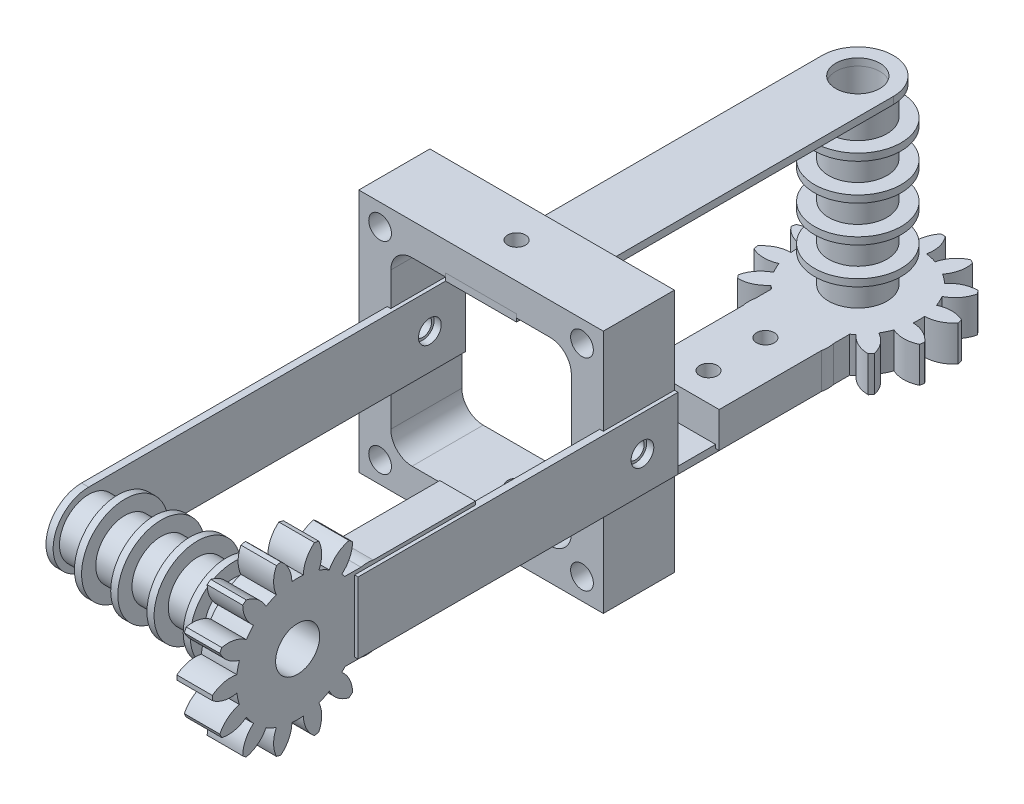
from build123d import *
from build123d.topology import SkipClean

# Parameters (mm, degrees)
BASPROSKE_W              = 5
BASPROSKE_H              = 12
TOOTHCUT_DEPTH           = 18.691806013
TEETHCUTS_COUNT          = 14
TEETHCUTS_ANGLE          = 334.285714286
BORSKE_R                 = 3.1
BORE_DEPTH               = 50.0000508
SKETCH_2_W               = 20
SKETCH_2_H               = 11
EXTRUDE_1_DEPTH          = 5
SKETCH_3_W               = 17
SKETCH_3_H               = 10
CUT_EXTRUDE_1_DEPTH      = 0.5
SKETCH_5_W               = 10
SKETCH_5_H               = 10
SKETCH_5_W_2             = 8
SKETCH_5_H_2             = 8
EXTRUDE_2_DEPTH          = 40
SKETCH_12_W              = 9
SKETCH_12_H              = 10
CUT_EXTRUDE_4_DEPTH      = 63.83857643
CUT_EXTRUDE_2_DEPTH      = 50.726116758
CUT_EXTRUDE_2_DEPTH_BACK = 50.726116758
SKETCH_4_R               = 1.25
SKETCH_7_R               = 4.1
SKETCH_7_R_2             = 3.1
EXTRUDE_3_DEPTH          = 4
PATTERN_LINEAR_1_COUNT   = 5
PATTERN_LINEAR_1_PITCH   = 5.1
SKETCH_14_R              = 3.1
EXTRUDE_5_DEPTH          = 1
SKETCH_15_W              = 34.4
SKETCH_15_H              = 34.4
SKETCH_15_R              = 1.6
EXTRUDE_6_DEPTH          = 5
SKETCH_17_R              = 6.1
SKETCH_17_R_2            = 3.1
EXTRUDE_8_DEPTH          = 1
PATTERN_LINEAR_3_COUNT   = 4
PATTERN_LINEAR_3_PITCH   = 5.1
PATTERN_LINEAR_2_COUNT   = 2
PATTERN_LINEAR_2_PITCH   = 100
MOVE_BODY_2_ANGLE        = 180
MOVE_BODY_2_2_ANGLE      = 180
MOVE_BODY_2_3_ANGLE      = 180
MOVE_BODY_2_4_ANGLE      = 180
MOVE_BODY_2_5_ANGLE      = 180
MOVE_BODY_2_6_ANGLE      = 180
MOVE_BODY_2_7_ANGLE      = 180
MOVE_BODY_2_8_ANGLE      = 180
MOVE_BODY_2_9_ANGLE      = 180
MOVE_BODY_2_10_ANGLE     = 180
MOVE_BODY_2_11_ANGLE     = 180
MOVE_BODY_2_12_ANGLE     = 180
MOVE_BODY_2_13_ANGLE     = 180
CUT_EXTRUDE_5_DEPTH      = 70.120546873
CUT_EXTRUDE_5_DEPTH_BACK = 70.120546873
SKETCH_16_W              = 10
SKETCH_16_H              = 1
SKETCH_16_W_2            = 1
SKETCH_16_H_2            = 10
EXTRUDE_7_OUTLINE_W      = 10
EXTRUDE_7_OUTLINE_H      = 1
EXTRUDE_7_DEPTH          = 5
EXTRUDE_7_2_OUTLINE_W    = 10
EXTRUDE_7_2_OUTLINE_H    = 1
EXTRUDE_7_2_DEPTH        = 5
EXTRUDE_START            = -5
EXTRUDE_7_3_OUTLINE_W    = 1
EXTRUDE_7_3_OUTLINE_H    = 10
EXTRUDE_7_3_DEPTH        = 5
EXTRUDE_7_4_OUTLINE_W    = 1
EXTRUDE_7_4_OUTLINE_H    = 10
EXTRUDE_7_4_DEPTH        = 5
SKETCH_21_R              = 1.25
CUT_EXTRUDE_6_DEPTH      = 115.870796985
SKETCH_22_R              = 1.25
CUT_EXTRUDE_7_DEPTH      = 118.244914602
SKETCH_23_R              = 1.6
CUT_EXTRUDE_8_DEPTH      = 115.870796985
SKETCH_24_R              = 1.6
CUT_EXTRUDE_9_DEPTH      = 118.244914602


with BuildPart() as part:
    # BasProSke → Base-Revolve (revolve)
    with BuildSketch(Plane(origin=(0, 0, 0), x_dir=(1, 0, 0), z_dir=(0, 1, 0)), mode=Mode.PRIVATE) as base_revolve_sk:
        with Locations((2.5, 6)):
            Rectangle(BASPROSKE_W, BASPROSKE_H)
    revolve(base_revolve_sk.sketch.rotate(Axis((-10, 0, 0), (1, 0, 0)), 180), axis=Axis((-10, 0, 0), (1, 0, 0)))

    # TooCutSke → ToothCut (cut, through all)
    with BuildSketch(Plane(origin=(0, 0, 0), x_dir=(0, 0, -1), z_dir=(1, 0, 0))):
        with BuildLine():
            ThreePointArc((0.804845511, 8.586361261), (0, 8.624), (-0.804845511, 8.586361261))
            ThreePointArc((-0.804845511, 8.586361261), (-1.237812142, 10.362618414), (-2.384428228, 11.78663426))
            ThreePointArc((-2.384428228, 11.78663426), (0, 12.0254), (2.384428228, 11.78663426))
            ThreePointArc((2.384428228, 11.78663426), (1.237812142, 10.362618414), (0.804845511, 8.586361261))
        make_face()
    toothcut = extrude(amount=TOOTHCUT_DEPTH, mode=Mode.SUBTRACT)

    # TeethCuts: ToothCut ×14 about axis
    teethcuts_axis = Axis((-10, 0, 0), (1, 0, 0))
    for i in range(1, TEETHCUTS_COUNT):
        add(toothcut.rotate(teethcuts_axis, i * TEETHCUTS_ANGLE / (TEETHCUTS_COUNT - 1)), mode=Mode.SUBTRACT)

    # BorSke → Bore (cut, symmetric)
    with BuildSketch(Plane(origin=(0, 0, 0), x_dir=(0, 0, -1), z_dir=(1, 0, 0))):
        with Locations(Location((0, 0, 0), (0, 0, 180))):
            Circle(BORSKE_R)
    extrude(amount=BORE_DEPTH, both=True, mode=Mode.SUBTRACT)

    # ｽｹｯﾁ2 → ﾎﾞｽ - 押し出し1 (add)
    with BuildSketch(Plane(origin=(5, 0, 0), x_dir=(0, 0, -1), z_dir=(1, 0, 0))):
        with Locations((15, 0)):
            Rectangle(SKETCH_2_W, SKETCH_2_H)
    extrude(amount=-EXTRUDE_1_DEPTH)

    # ｽｹｯﾁ3 → ｶｯﾄ - 押し出し1 (cut)
    with BuildSketch(Plane(origin=(5, 0, 0), x_dir=(0, 0, -1), z_dir=(1, 0, 0))):
        with Locations((16.5, 0)):
            Rectangle(SKETCH_3_W, SKETCH_3_H)
    extrude(amount=-CUT_EXTRUDE_1_DEPTH, mode=Mode.SUBTRACT)

    # ｽｹｯﾁ4 → ｶｯﾄ - 押し出し2 (cut, two sides: drawn at the far end of the back side and taken through both)
    with BuildSketch(Plane.ZY.offset(-CUT_EXTRUDE_2_DEPTH_BACK)):
        with Locations(Location((-21, 0, 0), (0, 0, 180))):
            Circle(SKETCH_4_R)
        with Locations(Location((-13, 0, 0), (0, 0, 180))):
            Circle(SKETCH_4_R)
    extrude(amount=CUT_EXTRUDE_2_DEPTH + CUT_EXTRUDE_2_DEPTH_BACK, mode=Mode.SUBTRACT)


with BuildPart() as body_2:
    # ｽｹｯﾁ5 → ﾎﾞｽ - 押し出し2 (new body)
    with BuildSketch(Plane(origin=(0, 0, -8), x_dir=(-1, 0, 0), z_dir=(0, 0, -1))):
        with Locations((-9.5, 0)):
            Rectangle(SKETCH_5_W, SKETCH_5_H)
        with Locations((-9.5, 0)):
            Rectangle(SKETCH_5_W_2, SKETCH_5_H_2, mode=Mode.SUBTRACT)
    extrude(amount=EXTRUDE_2_DEPTH)

    # ｽｹｯﾁ12 → ｶｯﾄ - 押し出し4 (cut, through all)
    with BuildSketch(Plane(origin=(0, 0, -48), x_dir=(-1, 0, 0), z_dir=(0, 0, -1))):
        with Locations((-10, 0)):
            Rectangle(SKETCH_12_W, SKETCH_12_H)
    extrude(amount=-CUT_EXTRUDE_4_DEPTH, mode=Mode.SUBTRACT)


with BuildPart() as body_3:
    # ｽｹｯﾁ7 → ﾎﾞｽ - 押し出し3 (new body)
    with BuildSketch(Plane.ZY):
        Circle(SKETCH_7_R)
        Circle(SKETCH_7_R_2, mode=Mode.SUBTRACT)
    extrude(amount=EXTRUDE_3_DEPTH)


with BuildPart() as pattern_linear_1_1:
    # 直線ﾊﾟﾀｰﾝ1: pattern copy
    add(body_3.part.moved(Location(Vector(-1, 0, 0) * (1 * PATTERN_LINEAR_1_PITCH))))


with BuildPart() as pattern_linear_1_2:
    # 直線ﾊﾟﾀｰﾝ1: pattern copy
    add(body_3.part.moved(Location(Vector(-1, 0, 0) * (2 * PATTERN_LINEAR_1_PITCH))))


with BuildPart() as pattern_linear_1_3:
    # 直線ﾊﾟﾀｰﾝ1: pattern copy
    add(body_3.part.moved(Location(Vector(-1, 0, 0) * (3 * PATTERN_LINEAR_1_PITCH))))


with BuildPart() as pattern_linear_1_4:
    # 直線ﾊﾟﾀｰﾝ1: pattern copy
    add(body_3.part.moved(Location(Vector(-1, 0, 0) * (4 * PATTERN_LINEAR_1_PITCH))))


with BuildPart() as body_8:
    # ｽｹｯﾁ14 → ﾎﾞｽ - 押し出し5 (new body)
    with BuildSketch(Plane.ZY.offset(24.4)):
        with BuildLine():
            Line((-48, 5), (0, 5))
            ThreePointArc((0, 5), (5, 0), (0, -5))
            Line((0, -5), (-48, -5))
            Line((-48, -5), (-48, 5))
        make_face()
        Circle(SKETCH_14_R, mode=Mode.SUBTRACT)
    extrude(amount=EXTRUDE_5_DEPTH)


with BuildPart() as body_9:
    # ｽｹｯﾁ15 → ﾎﾞｽ - 押し出し6 (new body)
    with BuildSketch(Plane(origin=(0, 0, -48), x_dir=(-1, 0, 0), z_dir=(0, 0, -1))):
        with Locations((12.2, 0)):
            Rectangle(SKETCH_15_W, SKETCH_15_H)
        with Locations(Location((26.4, 14.2, 0), (0, 0, 90))):
            Circle(SKETCH_15_R, mode=Mode.SUBTRACT)
        with Locations(Location((26.4, -14.2, 0), (0, 0, 90))):
            Circle(SKETCH_15_R, mode=Mode.SUBTRACT)
        with Locations(Location((-2, -14.2, 0), (0, 0, 90))):
            Circle(SKETCH_15_R, mode=Mode.SUBTRACT)
        with Locations(Location((-2, 14.2, 0), (0, 0, 90))):
            Circle(SKETCH_15_R, mode=Mode.SUBTRACT)
        with BuildLine():
            Line((21.9, -12.7), (2.5, -12.7))
            ThreePointArc((2.5, -12.7), (0.378679656, -11.821320344), (-0.5, -9.7))
            Line((-0.5, -9.7), (-0.5, 9.7))
            ThreePointArc((-0.5, 9.7), (0.378679656, 11.821320344), (2.5, 12.7))
            Line((2.5, 12.7), (21.9, 12.7))
            ThreePointArc((21.9, 12.7), (24.021320344, 11.821320344), (24.9, 9.7))
            Line((24.9, 9.7), (24.9, -9.7))
            ThreePointArc((24.9, -9.7), (24.021320344, -11.821320344), (21.9, -12.7))
        make_face(mode=Mode.SUBTRACT)
    extrude(amount=-EXTRUDE_6_DEPTH)


with BuildPart() as body_10:
    # ｽｹｯﾁ17 → ﾎﾞｽ - 押し出し8 (new body)
    with BuildSketch(Plane.ZY.offset(4)):
        Circle(SKETCH_17_R)
        Circle(SKETCH_17_R_2, mode=Mode.SUBTRACT)
    extrude(amount=EXTRUDE_8_DEPTH)


with BuildPart() as pattern_linear_3_1:
    # 直線ﾊﾟﾀｰﾝ3: pattern copy
    add(body_10.part.moved(Location(Vector(-1, 0, 0) * (1 * PATTERN_LINEAR_3_PITCH))))


with BuildPart() as pattern_linear_3_2:
    # 直線ﾊﾟﾀｰﾝ3: pattern copy
    add(body_10.part.moved(Location(Vector(-1, 0, 0) * (2 * PATTERN_LINEAR_3_PITCH))))


with BuildPart() as pattern_linear_3_3:
    # 直線ﾊﾟﾀｰﾝ3: pattern copy
    add(body_10.part.moved(Location(Vector(-1, 0, 0) * (3 * PATTERN_LINEAR_3_PITCH))))


with BuildPart() as pattern_linear_2_1:
    # 直線ﾊﾟﾀｰﾝ2: pattern copy
    add(body_10.part.moved(Location(Vector(0, 0, -1) * (1 * PATTERN_LINEAR_2_PITCH))))


with BuildPart() as pattern_linear_2_2:
    # 直線ﾊﾟﾀｰﾝ2: pattern copy
    add(pattern_linear_3_1.part.moved(Location(Vector(0, 0, -1) * (1 * PATTERN_LINEAR_2_PITCH))))


with BuildPart() as pattern_linear_2_3:
    # 直線ﾊﾟﾀｰﾝ2: pattern copy
    add(pattern_linear_3_2.part.moved(Location(Vector(0, 0, -1) * (1 * PATTERN_LINEAR_2_PITCH))))


with BuildPart() as pattern_linear_2_4:
    # 直線ﾊﾟﾀｰﾝ2: pattern copy
    add(pattern_linear_3_3.part.moved(Location(Vector(0, 0, -1) * (1 * PATTERN_LINEAR_2_PITCH))))


with BuildPart() as pattern_linear_2_5:
    # 直線ﾊﾟﾀｰﾝ2: pattern copy
    add(body_3.part.moved(Location(Vector(0, 0, -1) * (1 * PATTERN_LINEAR_2_PITCH))))


with BuildPart() as pattern_linear_2_6:
    # 直線ﾊﾟﾀｰﾝ2: pattern copy
    add(pattern_linear_1_1.part.moved(Location(Vector(0, 0, -1) * (1 * PATTERN_LINEAR_2_PITCH))))


with BuildPart() as pattern_linear_2_7:
    # 直線ﾊﾟﾀｰﾝ2: pattern copy
    add(body_9.part.moved(Location(Vector(0, 0, -1) * (1 * PATTERN_LINEAR_2_PITCH))))


with BuildPart() as pattern_linear_2_8:
    # 直線ﾊﾟﾀｰﾝ2: pattern copy
    add(pattern_linear_1_2.part.moved(Location(Vector(0, 0, -1) * (1 * PATTERN_LINEAR_2_PITCH))))


with BuildPart() as pattern_linear_2_9:
    # 直線ﾊﾟﾀｰﾝ2: pattern copy
    add(pattern_linear_1_3.part.moved(Location(Vector(0, 0, -1) * (1 * PATTERN_LINEAR_2_PITCH))))


with BuildPart() as pattern_linear_2_10:
    # 直線ﾊﾟﾀｰﾝ2: pattern copy
    add(body_2.part.moved(Location(Vector(0, 0, -1) * (1 * PATTERN_LINEAR_2_PITCH))))


with BuildPart() as pattern_linear_2_11:
    # 直線ﾊﾟﾀｰﾝ2: pattern copy
    add(part.part.moved(Location(Vector(0, 0, -1) * (1 * PATTERN_LINEAR_2_PITCH))))


with BuildPart() as pattern_linear_2_12:
    # 直線ﾊﾟﾀｰﾝ2: pattern copy
    add(pattern_linear_1_4.part.moved(Location(Vector(0, 0, -1) * (1 * PATTERN_LINEAR_2_PITCH))))


with BuildPart() as pattern_linear_2_13:
    # 直線ﾊﾟﾀｰﾝ2: pattern copy
    add(body_8.part.moved(Location(Vector(0, 0, -1) * (1 * PATTERN_LINEAR_2_PITCH))))


with BuildPart() as pattern_linear_2_13_1:
    # Move Body 2: read off the stored shape, not the designer's step
    # Move Body 2: moved
    add(pattern_linear_2_13.part.moved(Location((12.2, 12.2, 196))).rotate(Axis((0, 0, 0), (0.7071067812, -0.7071067812, 0)), MOVE_BODY_2_ANGLE))

    # ﾎﾞｽ - 押し出し7: read off the stored shape, not the designer's step
    # ﾎﾞｽ - 押し出し7 outline → ﾎﾞｽ - 押し出し7 (add)
    with BuildSketch(Plane.XY.offset(-48)):
        with Locations((-12.2, 12.7)):
            Rectangle(EXTRUDE_7_OUTLINE_W, EXTRUDE_7_OUTLINE_H)
    extrude(amount=EXTRUDE_7_DEPTH)


with BuildPart() as pattern_linear_2_12_1:
    # Move Body 2 2: moved
    add(pattern_linear_2_12.part.moved(Location((12.2, 12.2, 196))).rotate(Axis((0, 0, 0), (0.7071067812, -0.7071067812, 0)), MOVE_BODY_2_2_ANGLE))


with BuildPart() as pattern_linear_2_11_1:
    # Move Body 2 3: moved
    add(pattern_linear_2_11.part.moved(Location((12.2, 12.2, 196))).rotate(Axis((0, 0, 0), (0.7071067812, -0.7071067812, 0)), MOVE_BODY_2_3_ANGLE))


with BuildPart() as pattern_linear_2_10_1:
    # Move Body 2 4: moved
    add(pattern_linear_2_10.part.moved(Location((12.2, 12.2, 196))).rotate(Axis((0, 0, 0), (0.7071067812, -0.7071067812, 0)), MOVE_BODY_2_4_ANGLE))

    # Extrude 7 2 outline → Extrude 7 2 (add)
    with BuildSketch(Plane.XY.offset(-48)):
        with Locations((-12.2, -17.2)):
            Rectangle(EXTRUDE_7_2_OUTLINE_W, EXTRUDE_7_2_OUTLINE_H)
    extrude(amount=EXTRUDE_7_2_DEPTH)


with BuildPart() as pattern_linear_2_9_1:
    # Move Body 2 5: moved
    add(pattern_linear_2_9.part.moved(Location((12.2, 12.2, 196))).rotate(Axis((0, 0, 0), (0.7071067812, -0.7071067812, 0)), MOVE_BODY_2_5_ANGLE))


with BuildPart() as pattern_linear_2_8_1:
    # Move Body 2 6: moved
    add(pattern_linear_2_8.part.moved(Location((12.2, 12.2, 196))).rotate(Axis((0, 0, 0), (0.7071067812, -0.7071067812, 0)), MOVE_BODY_2_6_ANGLE))


with BuildPart() as pattern_linear_2_6_1:
    # Move Body 2 7: moved
    add(pattern_linear_2_6.part.moved(Location((12.2, 12.2, 196))).rotate(Axis((0, 0, 0), (0.7071067812, -0.7071067812, 0)), MOVE_BODY_2_7_ANGLE))


with BuildPart() as pattern_linear_2_5_1:
    # Move Body 2 8: moved
    add(pattern_linear_2_5.part.moved(Location((12.2, 12.2, 196))).rotate(Axis((0, 0, 0), (0.7071067812, -0.7071067812, 0)), MOVE_BODY_2_8_ANGLE))


with BuildPart() as pattern_linear_2_4_1:
    # Move Body 2 9: moved
    add(pattern_linear_2_4.part.moved(Location((12.2, 12.2, 196))).rotate(Axis((0, 0, 0), (0.7071067812, -0.7071067812, 0)), MOVE_BODY_2_9_ANGLE))


with BuildPart() as pattern_linear_2_3_1:
    # Move Body 2 10: moved
    add(pattern_linear_2_3.part.moved(Location((12.2, 12.2, 196))).rotate(Axis((0, 0, 0), (0.7071067812, -0.7071067812, 0)), MOVE_BODY_2_10_ANGLE))


with BuildPart() as pattern_linear_2_2_1:
    # Move Body 2 11: moved
    add(pattern_linear_2_2.part.moved(Location((12.2, 12.2, 196))).rotate(Axis((0, 0, 0), (0.7071067812, -0.7071067812, 0)), MOVE_BODY_2_11_ANGLE))


with BuildPart() as pattern_linear_2_1_1:
    # Move Body 2 12: moved
    add(pattern_linear_2_1.part.moved(Location((12.2, 12.2, 196))).rotate(Axis((0, 0, 0), (0.7071067812, -0.7071067812, 0)), MOVE_BODY_2_12_ANGLE))


with BuildPart() as pattern_linear_2_7_1:
    # Move Body 2 13: moved
    add(pattern_linear_2_7.part.moved(Location((12.2, 12.2, 196))).rotate(Axis((0, 0, 0), (0.7071067812, -0.7071067812, 0)), MOVE_BODY_2_13_ANGLE))


with BuildPart() as cut_extrude_5_tool:
    # ｽｹｯﾁ16 → ｶｯﾄ - 押し出し5 (new, two sides: drawn at the far end of the back side and taken through both)
    with BuildSketch(Plane.XY.offset(-48).offset(-CUT_EXTRUDE_5_DEPTH_BACK)):
        with Locations((-12.2, -17.2)):
            Rectangle(SKETCH_16_W, SKETCH_16_H)
        with Locations((5, 0)):
            Rectangle(SKETCH_16_W_2, SKETCH_16_H_2)
        with Locations((-12.2, 12.7)):
            Rectangle(SKETCH_16_W, SKETCH_16_H)
        with Locations((-24.9, 0)):
            Rectangle(SKETCH_16_W_2, SKETCH_16_H_2)
    extrude(amount=CUT_EXTRUDE_5_DEPTH + CUT_EXTRUDE_5_DEPTH_BACK)


with BuildPart() as body_9_1:
    add(body_9.part)

    # ｶｯﾄ - 押し出し5: cut by cut_extrude_5_tool
    add(cut_extrude_5_tool.part, mode=Mode.SUBTRACT)


with BuildPart() as pattern_linear_2_7_2:
    add(pattern_linear_2_7_1.part)

    # ｶｯﾄ - 押し出し5: cut by cut_extrude_5_tool
    add(cut_extrude_5_tool.part, mode=Mode.SUBTRACT)


with BuildPart() as body_9_2:
    add(body_9_1.part)

    # Combine 1: union 直線ﾊﾟﾀｰﾝ2_7
    add(pattern_linear_2_7_2.part)

    # ｽｹｯﾁ21 → ｶｯﾄ - 押し出し6 (cut, through all)
    with SkipClean():  # the faces are left unmerged after this step: merging them gives an invalid solid
        with BuildSketch(Plane.ZY.offset(29.4)):
            with Locations((-48, 0)):
                Circle(SKETCH_21_R)
        extrude(amount=-CUT_EXTRUDE_6_DEPTH, mode=Mode.SUBTRACT)

    # ｽｹｯﾁ22 → ｶｯﾄ - 押し出し7 (cut, through all)
    with SkipClean():  # the faces are left unmerged after this step: merging them gives an invalid solid
        with BuildSketch(Plane.XZ.offset(17.7)):
            with Locations(Location((-12.2, -48, 0), (0, 0, 270))):
                Circle(SKETCH_22_R)
        extrude(amount=-CUT_EXTRUDE_7_DEPTH, mode=Mode.SUBTRACT)


with BuildPart() as body_8_1:
    add(body_8.part)

    # Extrude 7 3 outline → Extrude 7 3 (add)
    with BuildSketch(Plane.XY.offset(-48).offset(EXTRUDE_START)):
        with Locations((-24.9, 0)):
            Rectangle(EXTRUDE_7_3_OUTLINE_W, EXTRUDE_7_3_OUTLINE_H)
    extrude(amount=EXTRUDE_7_3_DEPTH)


with BuildPart() as body_2_1:
    add(body_2.part)

    # Extrude 7 4 outline → Extrude 7 4 (add)
    with BuildSketch(Plane.XY.offset(-48).offset(EXTRUDE_START)):
        with Locations((5, 0)):
            Rectangle(EXTRUDE_7_4_OUTLINE_W, EXTRUDE_7_4_OUTLINE_H)
    extrude(amount=EXTRUDE_7_4_DEPTH)


with BuildPart() as cut_extrude_8_tool:
    # ｽｹｯﾁ23 → ｶｯﾄ - 押し出し8 (new, through all)
    with BuildSketch(Plane.ZY.offset(29.4)):
        with Locations(Location((-48, 0, 0), (0, 0, 180))):
            Circle(SKETCH_23_R)
    extrude(amount=-CUT_EXTRUDE_8_DEPTH)


with BuildPart() as body_2_2:
    add(body_2_1.part)

    # ｶｯﾄ - 押し出し8: cut by cut_extrude_8_tool
    add(cut_extrude_8_tool.part, mode=Mode.SUBTRACT)


with BuildPart() as body_8_2:
    add(body_8_1.part)

    # ｶｯﾄ - 押し出し8: cut by cut_extrude_8_tool
    add(cut_extrude_8_tool.part, mode=Mode.SUBTRACT)


with BuildPart() as cut_extrude_9_tool:
    # ｽｹｯﾁ24 → ｶｯﾄ - 押し出し9 (new, through all)
    with BuildSketch(Plane(origin=(0, 17.2, 0), x_dir=(1, 0, 0), z_dir=(0, 1, 0))):
        with Locations((-12.2, 48)):
            Circle(SKETCH_24_R)
    extrude(amount=-CUT_EXTRUDE_9_DEPTH)


with BuildPart() as pattern_linear_2_13_2:
    add(pattern_linear_2_13_1.part)

    # ｶｯﾄ - 押し出し9: cut by cut_extrude_9_tool
    add(cut_extrude_9_tool.part, mode=Mode.SUBTRACT)


with BuildPart() as pattern_linear_2_10_2:
    add(pattern_linear_2_10_1.part)

    # ｶｯﾄ - 押し出し9: cut by cut_extrude_9_tool
    add(cut_extrude_9_tool.part, mode=Mode.SUBTRACT)


solid = Compound([part.part, body_3.part, pattern_linear_1_1.part, pattern_linear_1_2.part, pattern_linear_1_3.part, pattern_linear_1_4.part, body_10.part, pattern_linear_3_1.part, pattern_linear_3_2.part, pattern_linear_3_3.part, pattern_linear_2_12_1.part, pattern_linear_2_11_1.part, pattern_linear_2_9_1.part, pattern_linear_2_8_1.part, pattern_linear_2_6_1.part, pattern_linear_2_5_1.part, pattern_linear_2_4_1.part, pattern_linear_2_3_1.part, pattern_linear_2_2_1.part, pattern_linear_2_1_1.part, body_9_2.part, body_2_2.part, body_8_2.part, pattern_linear_2_13_2.part, pattern_linear_2_10_2.part])
